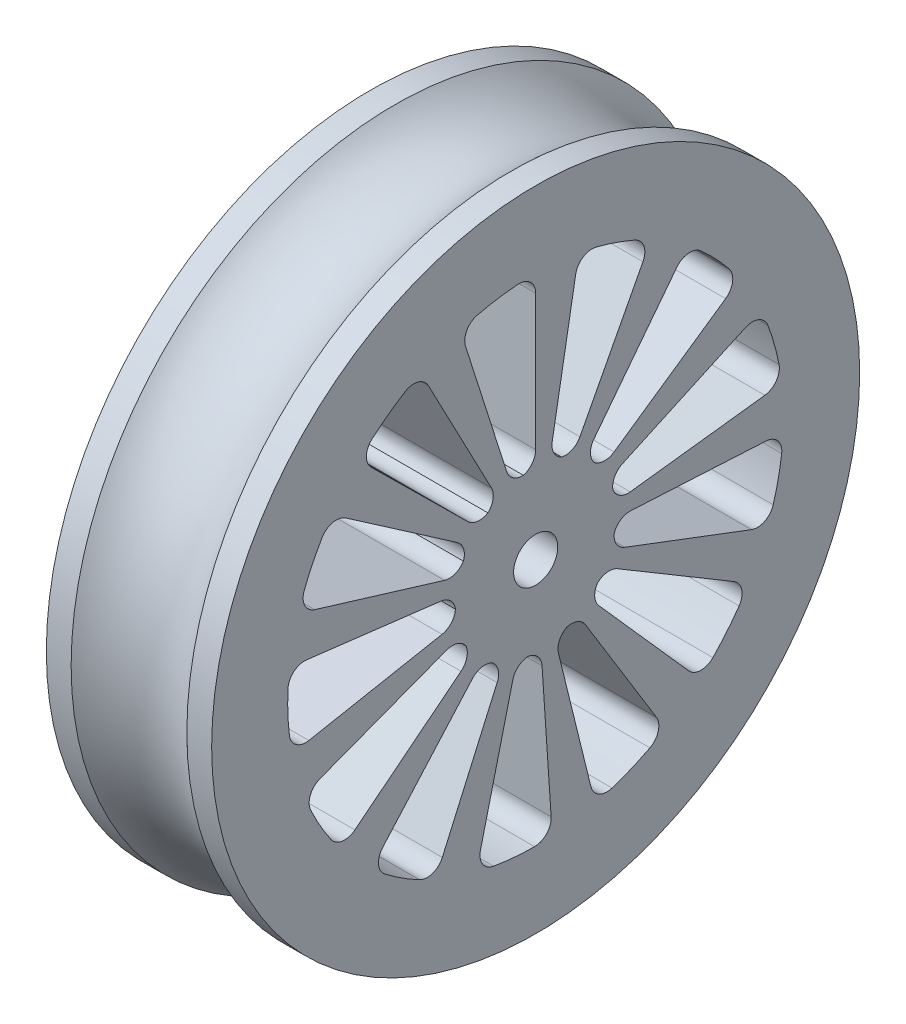
from build123d import *

# Parameters (mm, degrees)
CUT_EXTRUDE2_DEPTH = 30.467269979
FILLET1_R          = 1
SKETCH2_R          = 1.335
CUT_EXTRUDE3_DEPTH = 3.45
CUT_EXTRUDE5_DEPTH = 29.48196798


with BuildPart() as part:
    # Sketch1 → Revolve2 (revolve)
    with BuildSketch(Plane.XY, mode=Mode.PRIVATE) as revolve2_sk:
        with BuildLine():
            Line((0, 0), (10, 0))
            Line((10, 0), (10, 19.6))
            Line((10, 19.6), (8.5, 19.6))
            ThreePointArc((8.5, 19.6), (5, 18.170714214), (1.5, 19.6))
            Line((1.5, 19.6), (0, 19.6))
            Line((0, 19.6), (0, 0))
        make_face()
    revolve(revolve2_sk.sketch.rotate(Axis((0, 0, 0), (1, 0, 0)), 90), axis=Axis((0, 0, 0), (1, 0, 0)))

    # Sketch3 → Cut-Extrude2 (cut, through all)
    with BuildSketch(Plane(origin=(10, 0, 0), x_dir=(0, 0, -1), z_dir=(1, 0, 0))):
        with BuildLine():
            Line((2.604722665, 14.772116295), (0.84225046, 4.776639722))
            ThreePointArc((0.84225046, 4.776639722), (1.566792192, 4.590297931), (2.25405939, 4.294751347))
            Line((2.25405939, 4.294751347), (6.970847581, 13.281840385))
            ThreePointArc((6.970847581, 13.281840385), (4.845422268, 14.195840343), (2.604722665, 14.772116295))
        make_face()
        with BuildLine():
            Line((9.171312121, 11.869584406), (2.965590908, 3.838091119))
            ThreePointArc((2.965590908, 3.838091119), (3.520543403, 3.336382325), (3.991740938, 2.755299829))
            Line((3.991740938, 2.755299829), (12.344757988, 8.520971201))
            ThreePointArc((12.344757988, 8.520971201), (10.887544298, 10.318012365), (9.171312121, 11.869584406))
        make_face()
        with BuildLine():
            Line((13.636864497, 6.247873773), (4.409550218, 2.020282094))
            ThreePointArc((4.409550218, 2.020282094), (4.667780547, 1.318141736), (4.814962743, 0.584642325))
            Line((4.814962743, 0.584642325), (14.890633111, 1.808050204))
            ThreePointArc((14.890633111, 1.808050204), (14.435461139, 4.076452099), (13.636864497, 6.247873773))
        make_face()
        with BuildLine():
            Line((14.978375558, -0.805149446), (4.843334715, -0.260349211))
            ThreePointArc((4.843334715, -0.260349211), (4.74568542, -1.002069239), (4.53513461, -1.719949689))
            Line((4.53513461, -1.719949689), (14.02524364, -5.319073306))
            ThreePointArc((14.02524364, -5.319073306), (14.676387798, -3.098974216), (14.978375558, -0.805149446))
        make_face()
        with BuildLine():
            Line((12.888521288, -7.67372263), (4.167569596, -2.48133765))
            ThreePointArc((4.167569596, -2.48133765), (3.736410956, -3.092718228), (3.216361792, -3.630521958))
            Line((3.216361792, -3.630521958), (9.946839874, -11.227661223))
            ThreePointArc((9.946839874, -11.227661223), (11.555130883, -9.564462885), (12.888521288, -7.67372263))
        make_face()
        with BuildLine():
            Line((7.846062115, -12.784338438), (2.537064508, -4.133881536))
            ThreePointArc((2.537064508, -4.133881536), (1.87116977, -4.474862742), (1.160759249, -4.709385399))
            Line((1.160759249, -4.709385399), (3.589734964, -14.564127261))
            ThreePointArc((3.589734964, -14.564127261), (5.786732737, -13.838848371), (7.846062115, -12.784338438))
        make_face()
        with BuildLine():
            ThreePointArc((0.325348516, -4.839402981), (-0.42273386, -4.83187013), (-1.160759249, -4.709385399))
            Line((-1.160759249, -4.709385399), (-3.589734964, -14.564127261))
            ThreePointArc((-3.589734964, -14.564127261), (-1.307336141, -14.942920471), (1.006164666, -14.966216378))
            Line((1.006164666, -14.966216378), (0.325348516, -4.839402981))
        make_face()
        with BuildLine():
            ThreePointArc((-1.9609009, -4.436275524), (-2.619794257, -4.081954301), (-3.216361792, -3.630521958))
            Line((-3.216361792, -3.630521958), (-9.946839874, -11.227661223))
            ThreePointArc((-9.946839874, -11.227661223), (-8.101910065, -12.623749574), (-6.064232982, -13.719514508))
            Line((-6.064232982, -13.719514508), (-1.9609009, -4.436275524))
        make_face()
        with BuildLine():
            ThreePointArc((-3.797931552, -3.016850808), (-4.216691362, -2.396911935), (-4.53513461, -1.719949689))
            Line((-4.53513461, -1.719949689), (-14.02524364, -5.319073306))
            ThreePointArc((-14.02524364, -5.319073306), (-13.040434031, -7.412629781), (-11.745387936, -9.329837203))
            Line((-11.745387936, -9.329837203), (-3.797931552, -3.016850808))
        make_face()
        with BuildLine():
            ThreePointArc((-4.764901855, -0.906301928), (-4.847595293, -0.162765931), (-4.814962743, 0.584642325))
            Line((-4.814962743, 0.584642325), (-14.890633111, 1.808050204))
            ThreePointArc((-14.890633111, 1.808050204), (-14.991551715, -0.503365838), (-14.735816061, -2.802806631))
            Line((-14.735816061, -2.802806631), (-4.764901855, -0.906301928))
        make_face()
        with BuildLine():
            ThreePointArc((-4.640290566, 1.411869801), (-4.367973561, 2.108667787), (-3.991740938, 2.755299829))
            Line((-3.991740938, 2.755299829), (-12.344757988, 8.520971201))
            ThreePointArc((-12.344757988, 8.520971201), (-13.508285569, 6.521213153), (-14.350446312, 4.366313163))
            Line((-14.350446312, 4.366313163), (-4.640290566, 1.411869801))
        make_face()
        with BuildLine():
            ThreePointArc((-3.45264463, 3.406599173), (-2.887701727, 3.897031127), (-2.25405939, 4.294751347))
            Line((-2.25405939, 4.294751347), (-6.970847581, 13.281840385))
            ThreePointArc((-6.970847581, 13.281840385), (-8.930433992, 12.051860799), (-10.677562255, 10.53516323))
            Line((-10.677562255, 10.53516323), (-3.45264463, 3.406599173))
        make_face()
        with BuildLine():
            ThreePointArc((-1.474039418, 4.620917729), (-0.745892228, 4.7926316), (0, 4.850327089))
            Line((0, 4.850327089), (0, 15))
            ThreePointArc((0, 15), (-2.30672761, 14.821572377), (-4.558577364, 14.290534364))
            Line((-4.558577364, 14.290534364), (-1.474039418, 4.620917729))
        make_face()
    extrude(amount=-CUT_EXTRUDE2_DEPTH, mode=Mode.SUBTRACT)

    # Fillet1
    # the kernel refuses this fillet: 1 mm, written as the material it adds along each edge
    with BuildSketch(Plane(origin=(10, 14.290534364, 4.558577364), x_dir=(0, 0.26966420058726454, -0.9629544220375291), z_dir=(-1, 0, 0)), Plane(origin=(10, 10.53516323, 10.677562255), x_dir=(0, 0.6862830248559348, -0.7273345927388495), z_dir=(-1, 0, 0)), Plane(origin=(10, 4.366313163, 14.350446312), x_dir=(0, 0.9456826787369845, -0.3250911735757235), z_dir=(-1, 0, 0))) as fillet1_piece_1:
        with BuildLine():
            CenterArc((1.036376297, 0.999361225), FILLET1_R, 177.951978121, 94.096043758)
            Line((0.037015071, 1.035098339), (0, 0))
            ThreePointArc((0, 0), (0.536056705, -0.00958162), (1.07211341, 0))
        make_face()
    extrude(amount=10)
    with BuildSketch(Plane(origin=(10, 14.772116295, -2.604722665), x_dir=(0, -0.9848077530122082, 0.17364817766692997), z_dir=(-1, 0, 0)), Plane(origin=(10, 11.869584406, -9.171312121), x_dir=(0, -0.7913056270696629, 0.6114208080920107), z_dir=(-1, 0, 0)), Plane(origin=(10, -0.805149446, -14.978375558), x_dir=(0, 0.05367662970312148, 0.9985583705641419), z_dir=(-1, 0, 0)), Plane(origin=(10, 6.247873773, -13.636864497), x_dir=(0, -0.4165249182320387, 0.9091242998027241), z_dir=(-1, 0, 0)), Plane(origin=(10, -2.802806631, 14.735816061), x_dir=(0, 0.18685377538420386, -0.9823877374156649), z_dir=(-1, 0, 0)), Plane(origin=(10, -9.329837203, 11.745387936), x_dir=(0, 0.6219891468387043, -0.7830258624176221), z_dir=(-1, 0, 0)), Plane(origin=(10, -13.719514508, 6.064232982), x_dir=(0, 0.9146343005342535, -0.40428219882430744), z_dir=(-1, 0, 0)), Plane(origin=(10, -14.966216378, -1.006164666), x_dir=(0, 0.9977477585156255, 0.06707764439099849), z_dir=(-1, 0, 0)), Plane(origin=(10, -12.784338438, -7.846062115), x_dir=(0, 0.8522892291850337, 0.523070807649577), z_dir=(-1, 0, 0)), Plane(origin=(10, -7.67372263, -12.888521288), x_dir=(0, 0.5115815086468098, 0.859234752562217), z_dir=(-1, 0, 0))) as fillet1_piece_2:
        with BuildLine():
            CenterArc((1.035759956, -1), FILLET1_R, 90, 94.096043758)
            ThreePointArc((0.038314239, -1.071428571), (0.00958162, -0.536056705), (0, 0))
            Line((0, 0), (1.035759956, 0))
        make_face()
    extrude(amount=10)
    with BuildSketch(Plane(origin=(10, 1.808050204, 14.890633111), x_dir=(0, -0.9963823898655443, 0.08498313459638004), z_dir=(-1, 0, 0)), Plane(origin=(10, -5.319073306, 14.02524364), x_dir=(0, -0.9217464228410107, -0.38779315617968374), z_dir=(-1, 0, 0)), Plane(origin=(10, -14.564127261, 3.589734964), x_dir=(0, -0.20446413740132124, -0.9788740554927041), z_dir=(-1, 0, 0)), Plane(origin=(10, 1.808050204, -14.890633111), x_dir=(0, 0.9877671237764138, 0.15593623436030185), z_dir=(-1, 0, 0)), Plane(origin=(10, 8.520971201, -12.344757988), x_dir=(0, 0.8021571702215626, 0.5971129493338215), z_dir=(-1, 0, 0)), Plane(origin=(10, 15, 0), x_dir=(0, -0.03573711367703827, 0.9993612253364819), z_dir=(-1, 0, 0)), Plane(origin=(10, 13.281840385, 6.970847581), x_dir=(0, -0.49606996130055675, 0.8682825539507656), z_dir=(-1, 0, 0)), Plane(origin=(10, 8.520971201, 12.344757988), x_dir=(0, -0.8427591590813438, 0.5382908133941227), z_dir=(-1, 0, 0)), Plane(origin=(10, -11.227661223, -9.946839874), x_dir=(0, 0.6894486859841403, -0.7243345286500862), z_dir=(-1, 0, 0))) as fillet1_piece_3:
        with BuildLine():
            CenterArc((1.036376297, -0.999361225), FILLET1_R, 87.951978121, 94.096043758)
            Line((0.037015071, -1.035098339), (0, 0))
            ThreePointArc((0, 0), (0.536056705, 0.00958162), (1.07211341, 0))
        make_face()
    extrude(amount=10)
    with BuildSketch(Plane(origin=(10, -11.227661223, 9.946839874), x_dir=(0, 0.7485107481710997, -0.6631226582407966), z_dir=(-1, 0, 0)), Plane(origin=(10, -14.564127261, -3.589734964), x_dir=(0, 0.9709418174260528, 0.23931566428755488), z_dir=(-1, 0, 0)), Plane(origin=(10, -5.319073306, -14.02524364), x_dir=(0, 0.35460488704253845, 0.9350162426854137), z_dir=(-1, 0, 0)), Plane(origin=(10, 13.281840385, -6.970847581), x_dir=(0, -0.8854560256532109, 0.4647231720437667), z_dir=(-1, 0, 0))) as fillet1_piece_4:
        with BuildLine():
            CenterArc((1.035759956, 1), FILLET1_R, 175.903956242, 94.096043758)
            ThreePointArc((0.038314239, 1.071428571), (0.00958162, 0.536056705), (0, 0))
            Line((0, 0), (1.035759956, 0))
        make_face()
    extrude(amount=10)
    with BuildSketch(Plane(origin=(10, 4.620917729, 1.474039418), x_dir=(0, 0.22106072386394496, -0.9752600455082473), z_dir=(-1, 0, 0)), Plane(origin=(10, 3.406599173, 3.45264463), x_dir=(0, 0.6489654918969179, -0.7608178430655997), z_dir=(-1, 0, 0)), Plane(origin=(10, 1.411869801, 4.640290566), x_dir=(0, 0.9282000866181308, -0.3720814416254783), z_dir=(-1, 0, 0)), Plane(origin=(10, -3.016850808, 3.797931552), x_dir=(0, 0.8334947703768036, 0.5525273457074493), z_dir=(-1, 0, 0)), Plane(origin=(10, -4.436275524, 1.9609009), x_dir=(0, 0.4812507060426553, 0.8765830011661448), z_dir=(-1, 0, 0)), Plane(origin=(10, -4.133881536, -2.537064508), x_dir=(0, -0.44803210663360266, 0.8940174670695512), z_dir=(-1, 0, 0)), Plane(origin=(10, -2.48133765, -4.167569596), x_dir=(0, -0.8121833616638006, 0.5834022514839039), z_dir=(-1, 0, 0)), Plane(origin=(10, -0.260349211, -4.843334715), x_dir=(0, -0.990273196407553, 0.13913661084260984), z_dir=(-1, 0, 0)), Plane(origin=(10, 2.020282094, -4.409550218), x_dir=(0, -0.9415033759401247, -0.3370035505648989), z_dir=(-1, 0, 0)), Plane(origin=(10, 4.776639722, -0.84225046), x_dir=(0, -0.2574863919358113, -0.9662819246823765), z_dir=(-1, 0, 0)), Plane(origin=(10, 3.838091119, -2.965590908), x_dir=(0, -0.677046478390387, -0.7359402598711225), z_dir=(-1, 0, 0))) as fillet1_piece_5:
        with BuildLine():
            CenterArc((0.917918164, -0.996313974), FILLET1_R, 94.920965652, 80.158068696)
            Line((-0.07839581, -0.910532474), (0, 0))
            ThreePointArc((0, 0), (0.416068332, -0.017878433), (0.832136664, 0))
        make_face()
    extrude(amount=10)
    with BuildSketch(Plane(origin=(10, 4.850327089, 0), x_dir=(0, 1, 0), z_dir=(-1, 0, 0)), Plane(origin=(10, 4.294751347, 2.25405939), x_dir=(0, 0.8854560256532094, 0.46472317204376956), z_dir=(-1, 0, 0)), Plane(origin=(10, 2.755299829, 3.991740938), x_dir=(0, 0.5680647467311564, 0.822983865893656), z_dir=(-1, 0, 0)), Plane(origin=(10, 0.584642325, 4.814962743), x_dir=(0, 0.12053668025532241, 0.9927088740980541), z_dir=(-1, 0, 0)), Plane(origin=(10, -3.630521958, 3.216361792), x_dir=(0, -0.7485107481711016, 0.6631226582407946), z_dir=(-1, 0, 0)), Plane(origin=(10, -4.709385399, 1.160759249), x_dir=(0, -0.9709418174260522, 0.23931566428755724), z_dir=(-1, 0, 0)), Plane(origin=(10, -4.709385399, -1.160759249), x_dir=(0, -0.9709418174260516, -0.23931566428755952), z_dir=(-1, 0, 0)), Plane(origin=(10, -1.719949689, -4.53513461), x_dir=(0, -0.354604887042536, -0.9350162426854146), z_dir=(-1, 0, 0)), Plane(origin=(10, 4.294751347, -2.25405939), x_dir=(0, 0.8854560256532098, -0.4647231720437688), z_dir=(-1, 0, 0))) as fillet1_piece_6:
        with BuildLine():
            CenterArc((0.913901138, -1), FILLET1_R, 90, 80.158068696)
            ThreePointArc((-0.071381931, -0.829069386), (-0.017878433, -0.416068332), (0, 0))
            Line((0, 0), (0.913901138, 0))
        make_face()
    extrude(amount=10)
    with BuildSketch(Plane(origin=(10, -0.906301928, 4.764901855), x_dir=(0, -0.18685377538420458, 0.9823877374156648), z_dir=(-1, 0, 0)), Plane(origin=(10, -4.839402981, -0.325348516), x_dir=(0, -0.9977477585156251, -0.0670776443910017), z_dir=(-1, 0, 0))) as fillet1_piece_7:
        with BuildLine():
            CenterArc((0.913901138, 1), FILLET1_R, 189.841931304, 80.158068696)
            ThreePointArc((-0.071381931, 0.829069386), (-0.017878433, 0.416068332), (0, 0))
            Line((0, 0), (0.913901138, 0))
        make_face()
    extrude(amount=10)
    with BuildSketch(Plane(origin=(10, -1.719949689, 4.53513461), x_dir=(0, -0.9011512092511582, -0.4335048997014627), z_dir=(-1, 0, 0)), Plane(origin=(10, -3.630521958, -3.216361792), x_dir=(0, 0.7248867452699457, -0.6888680617737659), z_dir=(-1, 0, 0)), Plane(origin=(10, 0.584642325, -4.814962743), x_dir=(0, 0.9787099059298004, 0.2052484349145714), z_dir=(-1, 0, 0)), Plane(origin=(10, 2.755299829, -3.991740938), x_dir=(0, 0.7712208798416369, 0.6365676354451987), z_dir=(-1, 0, 0))) as fillet1_piece_8:
        with BuildLine():
            CenterArc((0.917918164, 0.996313974), FILLET1_R, 184.920965652, 80.158068696)
            Line((-0.07839581, 0.910532474), (0, 0))
            ThreePointArc((0, 0), (0.416068332, 0.017878433), (0.832136664, 0))
        make_face()
    extrude(amount=10)

    # Sketch2 → Cut-Extrude3 (cut)
    with BuildSketch(Plane(origin=(10, 0, 0), x_dir=(0, 0, -1), z_dir=(1, 0, 0))):
        Circle(SKETCH2_R)
    extrude(amount=-CUT_EXTRUDE3_DEPTH, mode=Mode.SUBTRACT)

    # Sketch5 → Cut-Extrude5 (cut, through all)
    with BuildSketch(Plane(origin=(6.55, 0, 0), x_dir=(0, 0, -1), z_dir=(1, 0, 0))):
        with BuildLine():
            Line((-0.947958332, 0.94), (0.947958332, 0.94))
            ThreePointArc((0.947958332, 0.94), (0, -1.335), (-0.947958332, 0.94))
        make_face()
    extrude(amount=-CUT_EXTRUDE5_DEPTH, mode=Mode.SUBTRACT)


solid = part.part
